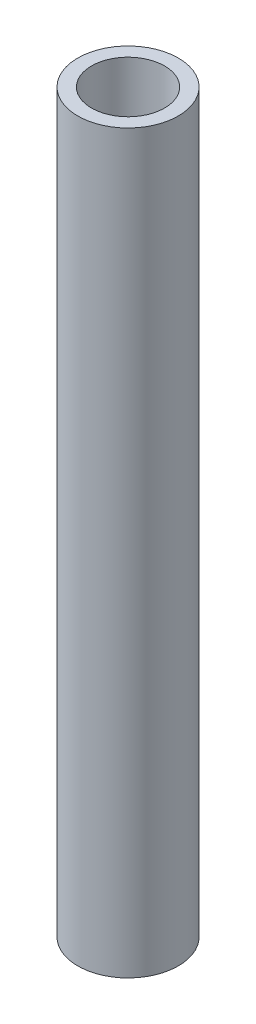
from build123d import *

# Parameters (mm, degrees)
SKETCH1_R           = 3.55
SKETCH1_R_2         = 2.58
BOSS_EXTRUDE1_DEPTH = 52


with BuildPart() as part:
    # Sketch1 → Boss-Extrude1 (new body)
    with BuildSketch(Plane(origin=(0, 0, 0), x_dir=(1, 0, 0), z_dir=(0, 1, 0))):
        Circle(SKETCH1_R)
        Circle(SKETCH1_R_2, mode=Mode.SUBTRACT)
    extrude(amount=BOSS_EXTRUDE1_DEPTH)


solid = part.part
